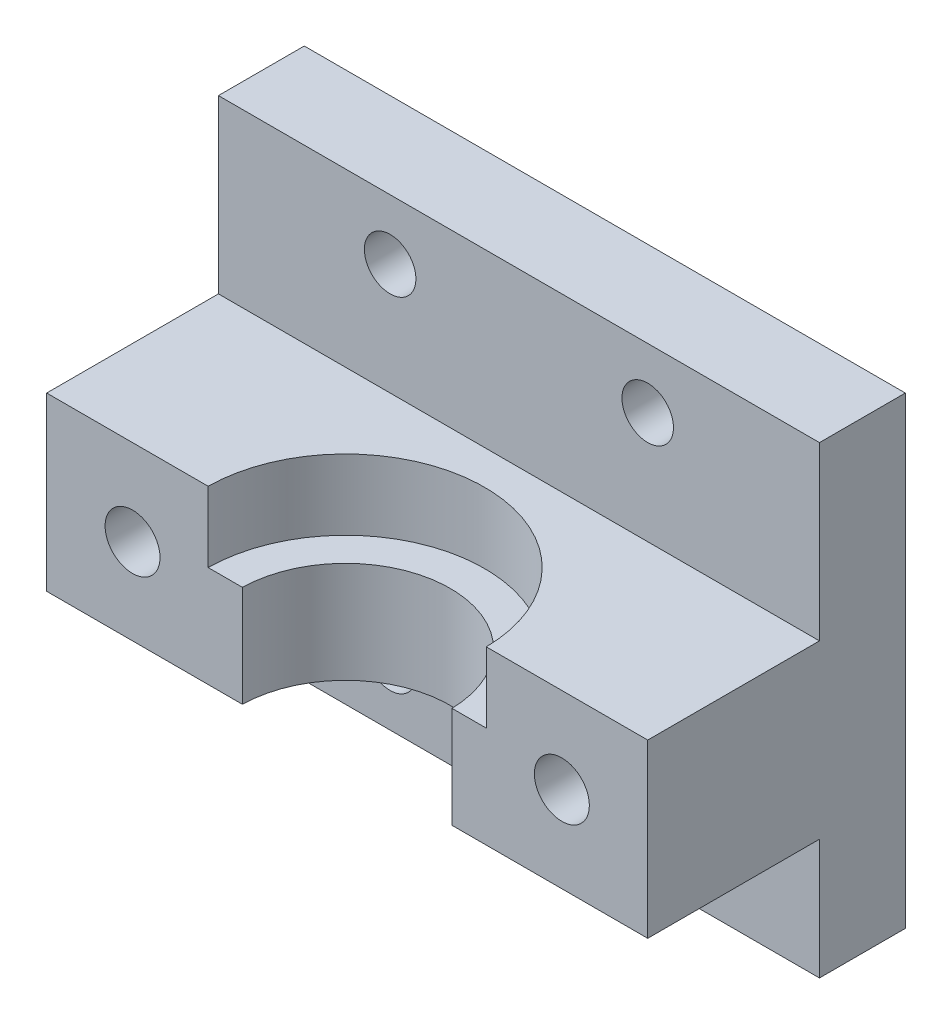
from build123d import *

# Parameters (mm, degrees)
SKETCH1_W           = 35
SKETCH1_H           = 27
SKETCH1_R           = 1.5
BOSS_EXTRUDE1_DEPTH = 25
SKETCH3_W           = 20
SKETCH3_H           = 10
SKETCH3_H_2         = 7
CUT_EXTRUDE1_DEPTH  = 51.783855702
SKETCH4_R           = 6.1
CUT_EXTRUDE6_DEPTH  = 47.249324319
SKETCH5_R           = 8.1
CUT_EXTRUDE7_DEPTH  = 4.1
SKETCH7_R           = 1.6
CUT_EXTRUDE8_DEPTH  = 51.783855702
CUT_EXTRUDE9_DEPTH  = 10
SKETCH10_W          = 35
SKETCH10_H          = 10
CUT_EXTRUDE10_DEPTH = 10


with BuildPart() as part:
    # Sketch1 → Boss-Extrude1 (new body)
    with BuildSketch(Plane.XY):
        with Locations((17.5, -13.5)):
            Rectangle(SKETCH1_W, SKETCH1_H)
        with Locations((10, -3.5)):
            Circle(SKETCH1_R, mode=Mode.SUBTRACT)
        with Locations((25, -3.5)):
            Circle(SKETCH1_R, mode=Mode.SUBTRACT)
        with Locations((10, -23.5)):
            Circle(SKETCH1_R, mode=Mode.SUBTRACT)
        with Locations((25, -23.5)):
            Circle(SKETCH1_R, mode=Mode.SUBTRACT)
    extrude(amount=BOSS_EXTRUDE1_DEPTH)

    # Sketch3 → Cut-Extrude1 (cut, through all)
    with BuildSketch(Plane.ZY):
        with Locations((15, -5)):
            Rectangle(SKETCH3_W, SKETCH3_H)
        with Locations((15, -23.5)):
            Rectangle(SKETCH3_W, SKETCH3_H_2)
    extrude(amount=-CUT_EXTRUDE1_DEPTH, mode=Mode.SUBTRACT)

    # Sketch4 → Cut-Extrude6 (cut, through all)
    with BuildSketch(Plane(origin=(0, -10, 0), x_dir=(1, 0, 0), z_dir=(0, 1, 0))):
        with Locations((17.499714283, -15.1)):
            Circle(SKETCH4_R)
    extrude(amount=-CUT_EXTRUDE6_DEPTH, mode=Mode.SUBTRACT)

    # Sketch5 → Cut-Extrude7 (cut)
    with BuildSketch(Plane(origin=(0, -10, 0), x_dir=(1, 0, 0), z_dir=(0, 1, 0))):
        with Locations((17.499714283, -15.1)):
            Circle(SKETCH5_R)
    extrude(amount=-CUT_EXTRUDE7_DEPTH, mode=Mode.SUBTRACT)

    # Sketch7 → Cut-Extrude8 (cut, through all)
    with BuildSketch(Plane.XY.offset(25)):
        with Locations((5, -15)):
            Circle(SKETCH7_R)
        with Locations((30, -15)):
            Circle(SKETCH7_R)
    extrude(amount=-CUT_EXTRUDE8_DEPTH, mode=Mode.SUBTRACT)

    # Sketch9 → Cut-Extrude9 (cut)
    with BuildSketch(Plane(origin=(0, 0, 0), x_dir=(-1, 0, 0), z_dir=(0, 0, -1))):
        Polygon((-30, -11.95), (-32.641377482, -13.475), (-32.641377482, -16.525), (-30, -18.05), (-27.358622518, -16.525), (-27.358622518, -13.475), align=None)
        Polygon((-5, -11.95), (-7.641377482, -13.475), (-7.641377482, -16.525), (-5, -18.05), (-2.358622518, -16.525), (-2.358622518, -13.475), align=None)
    extrude(amount=-CUT_EXTRUDE9_DEPTH, mode=Mode.SUBTRACT)

    # Sketch10 → Cut-Extrude10 (cut)
    with BuildSketch(Plane.XY.offset(25)):
        with Locations((17.5, -15)):
            Rectangle(SKETCH10_W, SKETCH10_H)
    extrude(amount=-CUT_EXTRUDE10_DEPTH, mode=Mode.SUBTRACT)


solid = part.part
